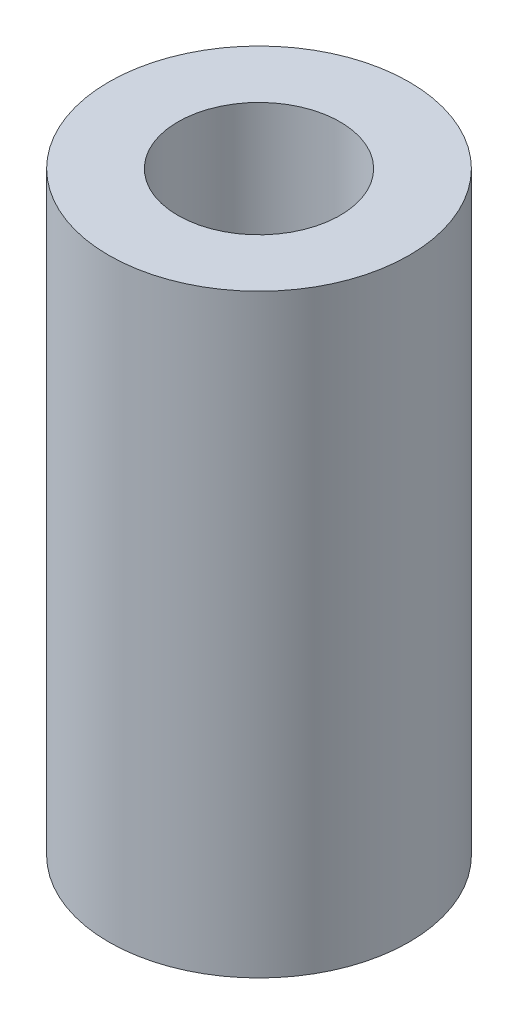
from build123d import *

# Parameters (mm, degrees)
SKETCH1_R           = 6.35
SKETCH1_R_2         = 3.429
BOSS_EXTRUDE1_DEPTH = 25.146


with BuildPart() as part:
    # Sketch1 → Boss-Extrude1 (new body)
    with BuildSketch(Plane(origin=(0, 0, 0), x_dir=(1, 0, 0), z_dir=(0, 1, 0))):
        Circle(SKETCH1_R)
        Circle(SKETCH1_R_2, mode=Mode.SUBTRACT)
    extrude(amount=BOSS_EXTRUDE1_DEPTH)


solid = part.part
